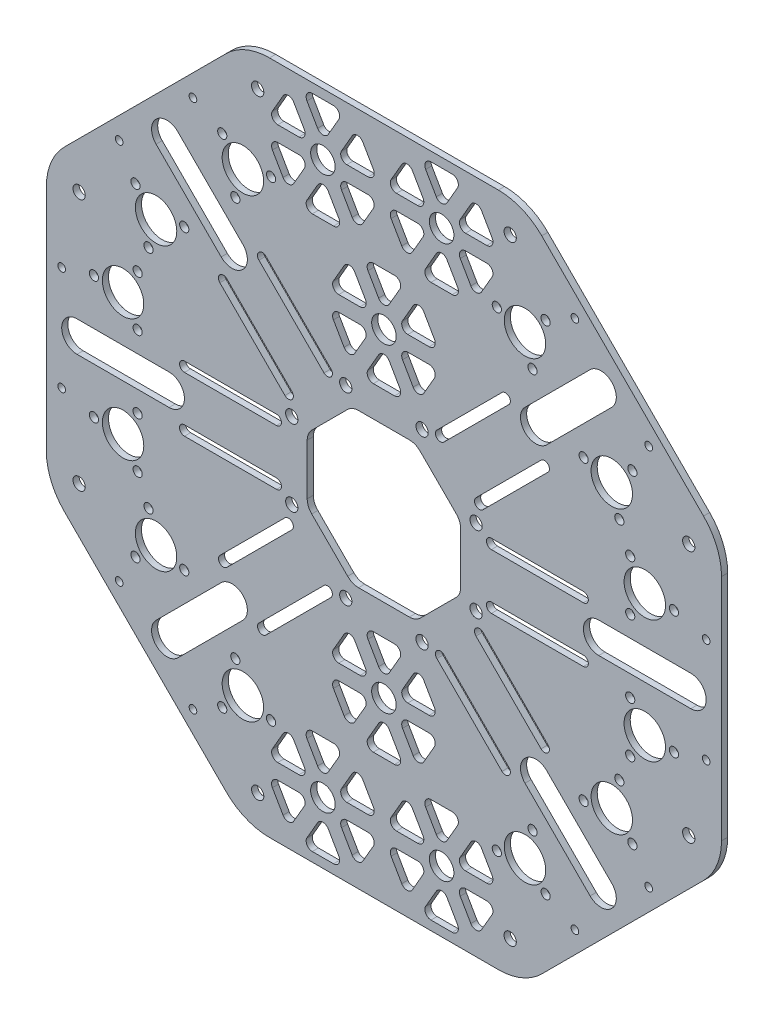
from build123d import *

# Parameters (mm, degrees)
EXTRUDE_1_DEPTH              = 2
SKETCH_2_R                   = 6.75
SKETCH_2_R_2                 = 1.5
CUT_EXTRUDE_1_DEPTH          = 10
PATTERN_CIRCULAR_1_OUTLINE_R = 1.5
PATTERN_CIRCULAR_1_DEPTH     = 2
PATTERN_CIRCULAR_2_OUTLINE_R = 1.5
PATTERN_CIRCULAR_2_DEPTH     = 2
MIRROR_6_COPY_1_SKETCH_R     = 6.75
MIRROR_6_COPY_1_SKETCH_R_2   = 1.5
MIRROR_6_COPY_1_DEPTH        = 10
MIRROR_6_COPY_2_SKETCH_R     = 1.5
MIRROR_6_COPY_2_DEPTH        = 2
MIRROR_6_COPY_3_SKETCH_R     = 1.5
MIRROR_6_COPY_3_DEPTH        = 2
MIRROR_6_COPY_4_SKETCH_R     = 6.75
MIRROR_6_COPY_4_SKETCH_R_2   = 1.5
MIRROR_6_COPY_4_DEPTH        = 10
MIRROR_6_COPY_5_SKETCH_R     = 1.5
MIRROR_6_COPY_5_DEPTH        = 2
MIRROR_6_COPY_6_SKETCH_R     = 1.5
MIRROR_6_COPY_6_DEPTH        = 2
FILLET_1_R                   = 20
SKETCH_3_R                   = 2
CUT_EXTRUDE_2_DEPTH          = 10
CUT_EXTRUDE_3_DEPTH          = 35
SKETCH_5_R                   = 2
CUT_EXTRUDE_4_DEPTH          = 35
FILLET_3_R                   = 5
SKETCH_9_R                   = 1.25
CUT_EXTRUDE_6_DEPTH          = 10
SKETCH_10_R                  = 4
CUT_EXTRUDE_8_DEPTH          = 10
FILLET_4_R                   = 2


# Read off the part's stored shape, not the designer's step: 阵列(圆周)1, 阵列(圆周)2
with BuildPart() as part:
    # 草图1 → 凸台-拉伸1 (new body)
    with BuildSketch(Plane.XY):
        Polygon((110, 45.563491861), (45.563491861, 110), (-45.563491861, 110), (-110, 45.563491861), (-110, -45.563491861), (-45.563491861, -110), (45.563491861, -110), (110, -45.563491861), align=None)
    extrude(amount=EXTRUDE_1_DEPTH)

    # 草图2 → 切除-拉伸1 (cut)
    with BuildSketch(Plane(origin=(0, 0, 0), x_dir=(-1, 0, 0), z_dir=(0, 0, -1))):
        with Locations((-85, -20)):
            Circle(SKETCH_2_R)
        with Locations((-94.5, -20)):
            Circle(SKETCH_2_R_2)
        with Locations(Location((-94.5, 20, 0), (0, 0, 180))):
            Circle(SKETCH_2_R_2)
        with Locations(Location((-85, 20, 0), (0, 0, 180))):
            Circle(SKETCH_2_R)
        with BuildLine():
            Line((-65, 10.6), (-35, 10.6))
            ThreePointArc((-35, 10.6), (-33.4, 9), (-35, 7.4))
            Line((-35, 7.4), (-65, 7.4))
            ThreePointArc((-65, 7.4), (-66.6, 9), (-65, 10.6))
        make_face()
        with BuildLine():
            Line((-65, -7.4), (-35, -7.4))
            ThreePointArc((-35, -7.4), (-33.4, -9), (-35, -10.6))
            Line((-35, -10.6), (-65, -10.6))
            ThreePointArc((-65, -10.6), (-66.6, -9), (-65, -7.4))
        make_face()
        with BuildLine():
            Line((-100, 5), (-70, 5))
            ThreePointArc((-70, 5), (-65, 0), (-70, -5))
            Line((-70, -5), (-100, -5))
            ThreePointArc((-100, -5), (-105, 0), (-100, 5))
        make_face()
    cut_extrude_1 = extrude(amount=-CUT_EXTRUDE_1_DEPTH, mode=Mode.SUBTRACT)

    # 阵列(圆周)1 outline → 阵列(圆周)1 (cut)
    with BuildSketch(Plane.XY):
        with Locations((80.25, 28.227241336)):
            Circle(PATTERN_CIRCULAR_1_OUTLINE_R)
        with Locations((80.25, 11.772758664)):
            Circle(PATTERN_CIRCULAR_1_OUTLINE_R)
    pattern_circular_1 = extrude(amount=PATTERN_CIRCULAR_1_DEPTH, mode=Mode.SUBTRACT)

    # 阵列(圆周)2 outline → 阵列(圆周)2 (cut)
    with BuildSketch(Plane.XY):
        with Locations((80.25, -11.772758664)):
            Circle(PATTERN_CIRCULAR_2_OUTLINE_R)
        with Locations((80.25, -28.227241336)):
            Circle(PATTERN_CIRCULAR_2_OUTLINE_R)
    pattern_circular_2 = extrude(amount=PATTERN_CIRCULAR_2_DEPTH, mode=Mode.SUBTRACT)

    # 镜向2: 切除-拉伸1, 阵列(圆周)1, 阵列(圆周)2 across plane
    add(cut_extrude_1.mirror(Plane(origin=(0, 0, 0), x_dir=(0, 0, 1), z_dir=(0.38268343236508945, 0.923879532511287, 0))), mode=Mode.SUBTRACT)
    add(pattern_circular_1.mirror(Plane(origin=(0, 0, 0), x_dir=(0, 0, 1), z_dir=(0.38268343236508945, 0.923879532511287, 0))), mode=Mode.SUBTRACT)
    add(pattern_circular_2.mirror(Plane(origin=(0, 0, 0), x_dir=(0, 0, 1), z_dir=(0.38268343236508945, 0.923879532511287, 0))), mode=Mode.SUBTRACT)

    # 镜向5: 切除-拉伸1, 阵列(圆周)1, 阵列(圆周)2 across plane
    add(cut_extrude_1.mirror(Plane(origin=(0, 0, 0), x_dir=(0, 0, 1), z_dir=(-0.3826834323650899, 0.9238795325112867, 0))), mode=Mode.SUBTRACT)
    add(pattern_circular_1.mirror(Plane(origin=(0, 0, 0), x_dir=(0, 0, 1), z_dir=(-0.3826834323650899, 0.9238795325112867, 0))), mode=Mode.SUBTRACT)
    add(pattern_circular_2.mirror(Plane(origin=(0, 0, 0), x_dir=(0, 0, 1), z_dir=(-0.3826834323650899, 0.9238795325112867, 0))), mode=Mode.SUBTRACT)

    # 镜向6: 切除-拉伸1, 阵列(圆周)1, 阵列(圆周)2 across plane
    add(cut_extrude_1.mirror(Plane(origin=(0, 0, 0), x_dir=(0, 0, 1), z_dir=(1, 0, 0))), mode=Mode.SUBTRACT)
    add(pattern_circular_1.mirror(Plane(origin=(0, 0, 0), x_dir=(0, 0, 1), z_dir=(1, 0, 0))), mode=Mode.SUBTRACT)
    add(pattern_circular_2.mirror(Plane(origin=(0, 0, 0), x_dir=(0, 0, 1), z_dir=(1, 0, 0))), mode=Mode.SUBTRACT)

    # 镜向6 copy 1 sketch → 镜向6 copy 1 (cut)
    with BuildSketch(Plane(origin=(0, 0, 0), x_dir=(0.707106781186548, 0.7071067811865471, 0), z_dir=(0, 0, -1))):
        with Locations((-85, -20)):
            Circle(MIRROR_6_COPY_1_SKETCH_R)
        with Locations((-94.5, -20)):
            Circle(MIRROR_6_COPY_1_SKETCH_R_2)
        with Locations(Location((-94.5, 20, 0), (0, 0, 180))):
            Circle(MIRROR_6_COPY_1_SKETCH_R_2)
        with Locations(Location((-85, 20, 0), (0, 0, 180))):
            Circle(MIRROR_6_COPY_1_SKETCH_R)
        with BuildLine():
            Line((-65, 10.6), (-35, 10.6))
            ThreePointArc((-35, 10.6), (-33.4, 9), (-35, 7.4))
            Line((-35, 7.4), (-65, 7.4))
            ThreePointArc((-65, 7.4), (-66.6, 9), (-65, 10.6))
        make_face()
        with BuildLine():
            Line((-65, -7.4), (-35, -7.4))
            ThreePointArc((-35, -7.4), (-33.4, -9), (-35, -10.6))
            Line((-35, -10.6), (-65, -10.6))
            ThreePointArc((-65, -10.6), (-66.6, -9), (-65, -7.4))
        make_face()
        with BuildLine():
            Line((-100, 5), (-70, 5))
            ThreePointArc((-70, 5), (-65, 0), (-70, -5))
            Line((-70, -5), (-100, -5))
            ThreePointArc((-100, -5), (-105, 0), (-100, 5))
        make_face()
    extrude(amount=-MIRROR_6_COPY_1_DEPTH, mode=Mode.SUBTRACT)

    # 镜向6 copy 2 sketch → 镜向6 copy 2 (cut)
    with BuildSketch(Plane(origin=(0, 0, 0), x_dir=(-0.707106781186548, -0.7071067811865471, 0), z_dir=(0, 0, 1))):
        with Locations((80.25, 28.227241336)):
            Circle(MIRROR_6_COPY_2_SKETCH_R)
        with Locations((80.25, 11.772758664)):
            Circle(MIRROR_6_COPY_2_SKETCH_R)
    extrude(amount=MIRROR_6_COPY_2_DEPTH, mode=Mode.SUBTRACT)

    # 镜向6 copy 3 sketch → 镜向6 copy 3 (cut)
    with BuildSketch(Plane(origin=(0, 0, 0), x_dir=(-0.707106781186548, -0.7071067811865471, 0), z_dir=(0, 0, 1))):
        with Locations((80.25, -11.772758664)):
            Circle(MIRROR_6_COPY_3_SKETCH_R)
        with Locations((80.25, -28.227241336)):
            Circle(MIRROR_6_COPY_3_SKETCH_R)
    extrude(amount=MIRROR_6_COPY_3_DEPTH, mode=Mode.SUBTRACT)

    # 镜向6 copy 4 sketch → 镜向6 copy 4 (cut)
    with BuildSketch(Plane(origin=(0, 0, 0), x_dir=(0.7071067811865474, -0.7071067811865477, 0), z_dir=(0, 0, -1))):
        with Locations((-85, -20)):
            Circle(MIRROR_6_COPY_4_SKETCH_R)
        with Locations((-94.5, -20)):
            Circle(MIRROR_6_COPY_4_SKETCH_R_2)
        with Locations(Location((-94.5, 20, 0), (0, 0, 180))):
            Circle(MIRROR_6_COPY_4_SKETCH_R_2)
        with Locations(Location((-85, 20, 0), (0, 0, 180))):
            Circle(MIRROR_6_COPY_4_SKETCH_R)
        with BuildLine():
            Line((-65, 10.6), (-35, 10.6))
            ThreePointArc((-35, 10.6), (-33.4, 9), (-35, 7.4))
            Line((-35, 7.4), (-65, 7.4))
            ThreePointArc((-65, 7.4), (-66.6, 9), (-65, 10.6))
        make_face()
        with BuildLine():
            Line((-65, -7.4), (-35, -7.4))
            ThreePointArc((-35, -7.4), (-33.4, -9), (-35, -10.6))
            Line((-35, -10.6), (-65, -10.6))
            ThreePointArc((-65, -10.6), (-66.6, -9), (-65, -7.4))
        make_face()
        with BuildLine():
            Line((-100, 5), (-70, 5))
            ThreePointArc((-70, 5), (-65, 0), (-70, -5))
            Line((-70, -5), (-100, -5))
            ThreePointArc((-100, -5), (-105, 0), (-100, 5))
        make_face()
    extrude(amount=-MIRROR_6_COPY_4_DEPTH, mode=Mode.SUBTRACT)

    # 镜向6 copy 5 sketch → 镜向6 copy 5 (cut)
    with BuildSketch(Plane(origin=(0, 0, 0), x_dir=(-0.7071067811865474, 0.7071067811865477, 0), z_dir=(0, 0, 1))):
        with Locations((80.25, 28.227241336)):
            Circle(MIRROR_6_COPY_5_SKETCH_R)
        with Locations((80.25, 11.772758664)):
            Circle(MIRROR_6_COPY_5_SKETCH_R)
    extrude(amount=MIRROR_6_COPY_5_DEPTH, mode=Mode.SUBTRACT)

    # 镜向6 copy 6 sketch → 镜向6 copy 6 (cut)
    with BuildSketch(Plane(origin=(0, 0, 0), x_dir=(-0.7071067811865474, 0.7071067811865477, 0), z_dir=(0, 0, 1))):
        with Locations((80.25, -11.772758664)):
            Circle(MIRROR_6_COPY_6_SKETCH_R)
        with Locations((80.25, -28.227241336)):
            Circle(MIRROR_6_COPY_6_SKETCH_R)
    extrude(amount=MIRROR_6_COPY_6_DEPTH, mode=Mode.SUBTRACT)

    # 圆角1
    fillet_1_edges = [part.edges().sort_by_distance(p)[0] for p in [
        (110, -45.563491861, 1),
        (45.563491861, -110, 1),
        (-45.563491861, -110, 1),
        (-110, -45.563491861, 1),
        (-110, 45.563491861, 1),
        (-45.563491861, 110, 1),
        (45.563491861, 110, 1),
        (110, 45.563491861, 1),
    ]]
    fillet(fillet_1_edges, radius=FILLET_1_R)

    # 草图3 → 切除-拉伸2 (cut)
    with BuildSketch(Plane(origin=(0, 0, 0), x_dir=(-1, 0, 0), z_dir=(0, 0, -1))):
        with Locations((-99.317049745, 41.138468979)):
            Circle(SKETCH_3_R)
        with Locations((-41.138468979, 99.317049745)):
            Circle(SKETCH_3_R)
        with Locations((41.138468979, 99.317049745)):
            Circle(SKETCH_3_R)
        with Locations((99.317049745, 41.138468979)):
            Circle(SKETCH_3_R)
        with Locations((99.317049745, -41.138468979)):
            Circle(SKETCH_3_R)
        with Locations((41.138468979, -99.317049745)):
            Circle(SKETCH_3_R)
        with Locations((-41.138468979, -99.317049745)):
            Circle(SKETCH_3_R)
        with Locations((-99.317049745, -41.138468979)):
            Circle(SKETCH_3_R)
    extrude(amount=-CUT_EXTRUDE_2_DEPTH, mode=Mode.SUBTRACT)

    # 草图4 → 切除-拉伸3 (cut)
    with BuildSketch(Plane.XY.offset(2)):
        Polygon((10.355339059, -25), (25, -10.355339059), (25, 10.355339059), (10.355339059, 25), (-10.355339059, 25), (-25, 10.355339059), (-25, -10.355339059), (-10.355339059, -25), align=None)
    extrude(amount=-CUT_EXTRUDE_3_DEPTH, mode=Mode.SUBTRACT)

    # 草图5 → 切除-拉伸4 (cut)
    with BuildSketch(Plane.XY.offset(2)):
        with Locations((-30.026084807, 12.437211552)):
            Circle(SKETCH_5_R)
        with Locations((-12.437211552, 30.026084807)):
            Circle(SKETCH_5_R)
        with Locations((12.437211552, 30.026084807)):
            Circle(SKETCH_5_R)
        with Locations((30.026084807, 12.437211552)):
            Circle(SKETCH_5_R)
        with Locations((30.026084807, -12.437211552)):
            Circle(SKETCH_5_R)
        with Locations((12.437211552, -30.026084807)):
            Circle(SKETCH_5_R)
        with Locations((-12.437211552, -30.026084807)):
            Circle(SKETCH_5_R)
        with Locations((-30.026084807, -12.437211552)):
            Circle(SKETCH_5_R)
    extrude(amount=-CUT_EXTRUDE_4_DEPTH, mode=Mode.SUBTRACT)

    # 圆角3
    fillet_3_edges = [part.edges().sort_by_distance(p)[0] for p in [
        (10.355339059, -25, 1),
        (-10.355339059, -25, 1),
        (-25, -10.355339059, 1),
        (-25, 10.355339059, 1),
        (-10.355339059, 25, 1),
        (10.355339059, 25, 1),
        (25, 10.355339059, 1),
        (25, -10.355339059, 1),
    ]]
    fillet(fillet_3_edges, radius=FILLET_3_R)

    # 草图9 → 切除-拉伸6 (cut)
    with BuildSketch(Plane(origin=(0, 0, 0), x_dir=(-1, 0, 0), z_dir=(0, 0, -1))):
        with Locations((-105, 17)):
            Circle(SKETCH_9_R)
        with Locations(Location((-105, -17, 0), (0, 0, 180))):
            Circle(SKETCH_9_R)
        with Locations((-62.225396744, 86.267027305)):
            Circle(SKETCH_9_R)
        with Locations(Location((-86.267027305, 62.225396744, 0), (0, 0, 180))):
            Circle(SKETCH_9_R)
        with Locations((86.267027305, 62.225396744)):
            Circle(SKETCH_9_R)
        with Locations(Location((62.225396744, 86.267027305, 0), (0, 0, 180))):
            Circle(SKETCH_9_R)
        with Locations((105, -17)):
            Circle(SKETCH_9_R)
        with Locations(Location((105, 17, 0), (0, 0, 180))):
            Circle(SKETCH_9_R)
        with Locations((62.225396744, -86.267027305)):
            Circle(SKETCH_9_R)
        with Locations(Location((86.267027305, -62.225396744, 0), (0, 0, 180))):
            Circle(SKETCH_9_R)
        with Locations((-86.267027305, -62.225396744)):
            Circle(SKETCH_9_R)
        with Locations(Location((-62.225396744, -86.267027305, 0), (0, 0, 180))):
            Circle(SKETCH_9_R)
    extrude(amount=-CUT_EXTRUDE_6_DEPTH, mode=Mode.SUBTRACT)

    # 草图10 → 切除-拉伸8 (cut)
    with BuildSketch(Plane(origin=(0, 0, 0), x_dir=(-1, 0, 0), z_dir=(0, 0, -1))):
        with Locations((0, -52)):
            Circle(SKETCH_10_R)
        with Locations((-18.793146677, -89.975190616)):
            Circle(SKETCH_10_R)
        with Locations((19.884100476, -89.975190616)):
            Circle(SKETCH_10_R)
        with Locations(Location((19.884100476, 89.975190616, 0), (0, 0, 180))):
            Circle(SKETCH_10_R)
        with Locations(Location((-18.793146677, 89.975190616, 0), (0, 0, 180))):
            Circle(SKETCH_10_R)
        with Locations(Location((0, 52, 0), (0, 0, 180))):
            Circle(SKETCH_10_R)
        Polygon((4.330127019, -49.5), (18.186533479, -49.5), (11.258330249, -37.5), align=None)
        Polygon((0, -47), (6.92820323, -35), (-6.92820323, -35), align=None)
        Polygon((4.330127019, -54.5), (11.258330249, -66.5), (18.186533479, -54.5), align=None)
        Polygon((0, -57), (-6.92820323, -69), (6.92820323, -69), align=None)
        Polygon((-4.330127019, -54.5), (-18.186533479, -54.5), (-11.258330249, -66.5), align=None)
        Polygon((-4.330127019, -49.5), (-11.258330249, -37.5), (-18.186533479, -49.5), align=None)
        Polygon((1.697566996, 87.475190616), (15.553973457, 87.475190616), (8.625770227, 75.475190616), align=None)
        Polygon((8.625770227, 104.475190616), (15.553973457, 92.475190616), (1.697566996, 92.475190616), align=None)
        Polygon((26.812303706, 106.975190616), (19.884100476, 94.975190616), (12.955897246, 106.975190616), align=None)
        Polygon((38.070633955, 92.475190616), (24.214227495, 92.475190616), (31.142430725, 104.475190616), align=None)
        Polygon((31.142430725, 75.475190616), (24.214227495, 87.475190616), (38.070633955, 87.475190616), align=None)
        Polygon((-14.463019658, -87.475190616), (-0.606613198, -87.475190616), (-7.534816428, -75.475190616), align=None)
        Polygon((-18.793146677, -84.975190616), (-11.864943447, -72.975190616), (-25.721349908, -72.975190616), align=None)
        Polygon((-14.463019658, -92.475190616), (-7.534816428, -104.475190616), (-0.606613198, -92.475190616), align=None)
        Polygon((-18.793146677, -94.975190616), (-25.721349908, -106.975190616), (-11.864943447, -106.975190616), align=None)
        Polygon((-23.123273696, -92.475190616), (-36.979680157, -92.475190616), (-30.051476927, -104.475190616), align=None)
        Polygon((-23.123273696, -87.475190616), (-30.051476927, -75.475190616), (-36.979680157, -87.475190616), align=None)
        Polygon((24.214227495, -87.475190616), (38.070633955, -87.475190616), (31.142430725, -75.475190616), align=None)
        Polygon((19.884100476, -84.975190616), (26.812303706, -72.975190616), (12.955897246, -72.975190616), align=None)
        Polygon((24.214227495, -92.475190616), (31.142430725, -104.475190616), (38.070633955, -92.475190616), align=None)
        Polygon((19.884100476, -94.975190616), (12.955897246, -106.975190616), (26.812303706, -106.975190616), align=None)
        Polygon((15.553973457, -92.475190616), (1.697566996, -92.475190616), (8.625770227, -104.475190616), align=None)
        Polygon((15.553973457, -87.475190616), (8.625770227, -75.475190616), (1.697566996, -87.475190616), align=None)
        Polygon((12.955897246, 72.975190616), (19.884100476, 84.975190616), (26.812303706, 72.975190616), align=None)
        Polygon((-36.979680157, 87.475190616), (-23.123273696, 87.475190616), (-30.051476927, 75.475190616), align=None)
        Polygon((-30.051476927, 104.475190616), (-23.123273696, 92.475190616), (-36.979680157, 92.475190616), align=None)
        Polygon((-11.864943447, 106.975190616), (-18.793146677, 94.975190616), (-25.721349908, 106.975190616), align=None)
        Polygon((-0.606613198, 92.475190616), (-14.463019658, 92.475190616), (-7.534816428, 104.475190616), align=None)
        Polygon((-7.534816428, 75.475190616), (-14.463019658, 87.475190616), (-0.606613198, 87.475190616), align=None)
        Polygon((-25.721349908, 72.975190616), (-18.793146677, 84.975190616), (-11.864943447, 72.975190616), align=None)
        Polygon((-18.186533479, 49.5), (-4.330127019, 49.5), (-11.258330249, 37.5), align=None)
        Polygon((-11.258330249, 66.5), (-4.330127019, 54.5), (-18.186533479, 54.5), align=None)
        Polygon((6.92820323, 69), (0, 57), (-6.92820323, 69), align=None)
        Polygon((18.186533479, 54.5), (4.330127019, 54.5), (11.258330249, 66.5), align=None)
        Polygon((11.258330249, 37.5), (4.330127019, 49.5), (18.186533479, 49.5), align=None)
        Polygon((-6.92820323, 35), (0, 47), (6.92820323, 35), align=None)
    extrude(amount=-CUT_EXTRUDE_8_DEPTH, mode=Mode.SUBTRACT)

    # 圆角4
    fillet_4_edges = [part.edges().sort_by_distance(p)[0] for p in [
        (25.721349908, 106.975190616, 1),
        (11.864943447, 106.975190616, 1),
        (18.793146677, 94.975190616, 1),
        (7.534816428, 104.475190616, 1),
        (0.606613198, 92.475190616, 1),
        (14.463019658, 92.475190616, 1),
        (36.979680157, 92.475190616, 1),
        (30.051476927, 104.475190616, 1),
        (23.123273696, 92.475190616, 1),
        (6.92820323, 69, 1),
        (-6.92820323, 69, 1),
        (0, 57, 1),
        (-11.258330249, 66.5, 1),
        (-18.186533479, 54.5, 1),
        (-4.330127019, 54.5, 1),
        (-18.186533479, 49.5, 1),
        (-11.258330249, 37.5, 1),
        (-4.330127019, 49.5, 1),
        (18.186533479, 54.5, 1),
        (11.258330249, 66.5, 1),
        (4.330127019, 54.5, 1),
        (11.258330249, 37.5, 1),
        (18.186533479, 49.5, 1),
        (4.330127019, 49.5, 1),
        (0.606613198, 87.475190616, 1),
        (7.534816428, 75.475190616, 1),
        (14.463019658, 87.475190616, 1),
        (0, 47, 1),
        (-6.92820323, 35, 1),
        (6.92820323, 35, 1),
        (18.793146677, 84.975190616, 1),
        (11.864943447, 72.975190616, 1),
        (25.721349908, 72.975190616, 1),
        (-19.884100476, 84.975190616, 1),
        (-26.812303706, 72.975190616, 1),
        (-12.955897246, 72.975190616, 1),
        (-8.625770227, 75.475190616, 1),
        (-1.697566996, 87.475190616, 1),
        (-15.553973457, 87.475190616, 1),
        (-12.955897246, 106.975190616, 1),
        (-26.812303706, 106.975190616, 1),
        (-19.884100476, 94.975190616, 1),
        (-31.142430725, 104.475190616, 1),
        (-38.070633955, 92.475190616, 1),
        (-24.214227495, 92.475190616, 1),
        (-1.697566996, 92.475190616, 1),
        (-8.625770227, 104.475190616, 1),
        (-15.553973457, 92.475190616, 1),
        (0, -47, 1),
        (6.92820323, -35, 1),
        (-6.92820323, -35, 1),
        (23.123273696, -92.475190616, 1),
        (30.051476927, -104.475190616, 1),
        (36.979680157, -92.475190616, 1),
        (23.123273696, -87.475190616, 1),
        (36.979680157, -87.475190616, 1),
        (30.051476927, -75.475190616, 1),
        (-24.214227495, -87.475190616, 1),
        (-31.142430725, -75.475190616, 1),
        (-38.070633955, -87.475190616, 1),
        (-19.884100476, -84.975190616, 1),
        (-12.955897246, -72.975190616, 1),
        (-26.812303706, -72.975190616, 1),
        (-15.553973457, -92.475190616, 1),
        (-8.625770227, -104.475190616, 1),
        (-1.697566996, -92.475190616, 1),
        (-15.553973457, -87.475190616, 1),
        (-1.697566996, -87.475190616, 1),
        (-8.625770227, -75.475190616, 1),
        (-24.214227495, -92.475190616, 1),
        (-38.070633955, -92.475190616, 1),
        (-31.142430725, -104.475190616, 1),
        (-19.884100476, -94.975190616, 1),
        (-26.812303706, -106.975190616, 1),
        (-12.955897246, -106.975190616, 1),
        (0, -57, 1),
        (-6.92820323, -69, 1),
        (6.92820323, -69, 1),
        (4.330127019, -54.5, 1),
        (11.258330249, -66.5, 1),
        (18.186533479, -54.5, 1),
        (4.330127019, -49.5, 1),
        (18.186533479, -49.5, 1),
        (11.258330249, -37.5, 1),
        (-4.330127019, -54.5, 1),
        (-18.186533479, -54.5, 1),
        (-11.258330249, -66.5, 1),
        (-4.330127019, -49.5, 1),
        (-11.258330249, -37.5, 1),
        (-18.186533479, -49.5, 1),
        (14.463019658, -92.475190616, 1),
        (0.606613198, -92.475190616, 1),
        (7.534816428, -104.475190616, 1),
        (18.793146677, -94.975190616, 1),
        (11.864943447, -106.975190616, 1),
        (25.721349908, -106.975190616, 1),
        (14.463019658, -87.475190616, 1),
        (7.534816428, -75.475190616, 1),
        (0.606613198, -87.475190616, 1),
        (18.793146677, -84.975190616, 1),
        (25.721349908, -72.975190616, 1),
        (11.864943447, -72.975190616, 1),
        (-38.070633955, 87.475190616, 1),
        (-31.142430725, 75.475190616, 1),
        (-24.214227495, 87.475190616, 1),
        (30.051476927, 75.475190616, 1),
        (36.979680157, 87.475190616, 1),
        (23.123273696, 87.475190616, 1),
    ]]
    fillet(fillet_4_edges, radius=FILLET_4_R)


solid = part.part
